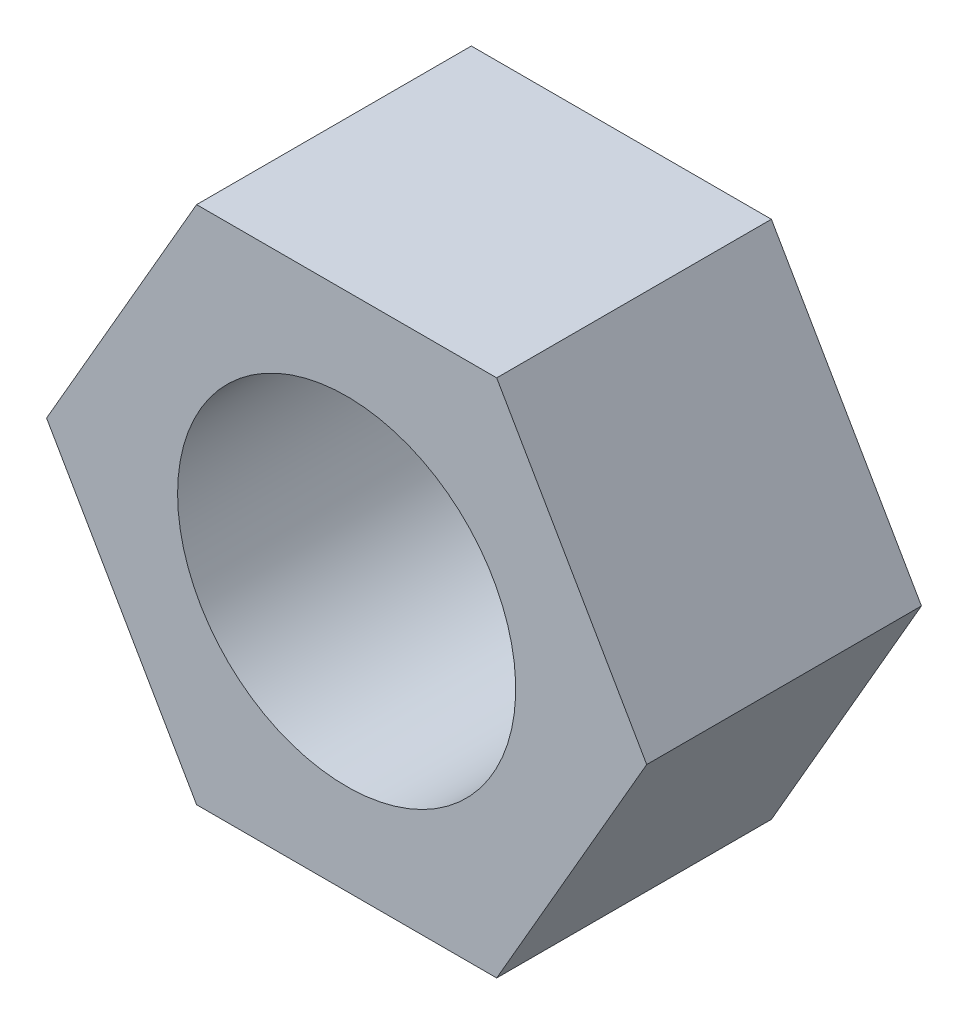
from build123d import *

# Parameters (mm, degrees)
SKETCH1_R           = 4
BOSS_EXTRUDE1_DEPTH = 6.5


with BuildPart() as part:
    # Sketch1 → Boss-Extrude1 (new body)
    with BuildSketch(Plane.XY):
        Polygon((7.1, 0), (3.55, 6.148780367), (-3.55, 6.148780367), (-7.1, 0), (-3.55, -6.148780367), (3.55, -6.148780367), align=None)
        Circle(SKETCH1_R, mode=Mode.SUBTRACT)
    extrude(amount=BOSS_EXTRUDE1_DEPTH)


solid = part.part
